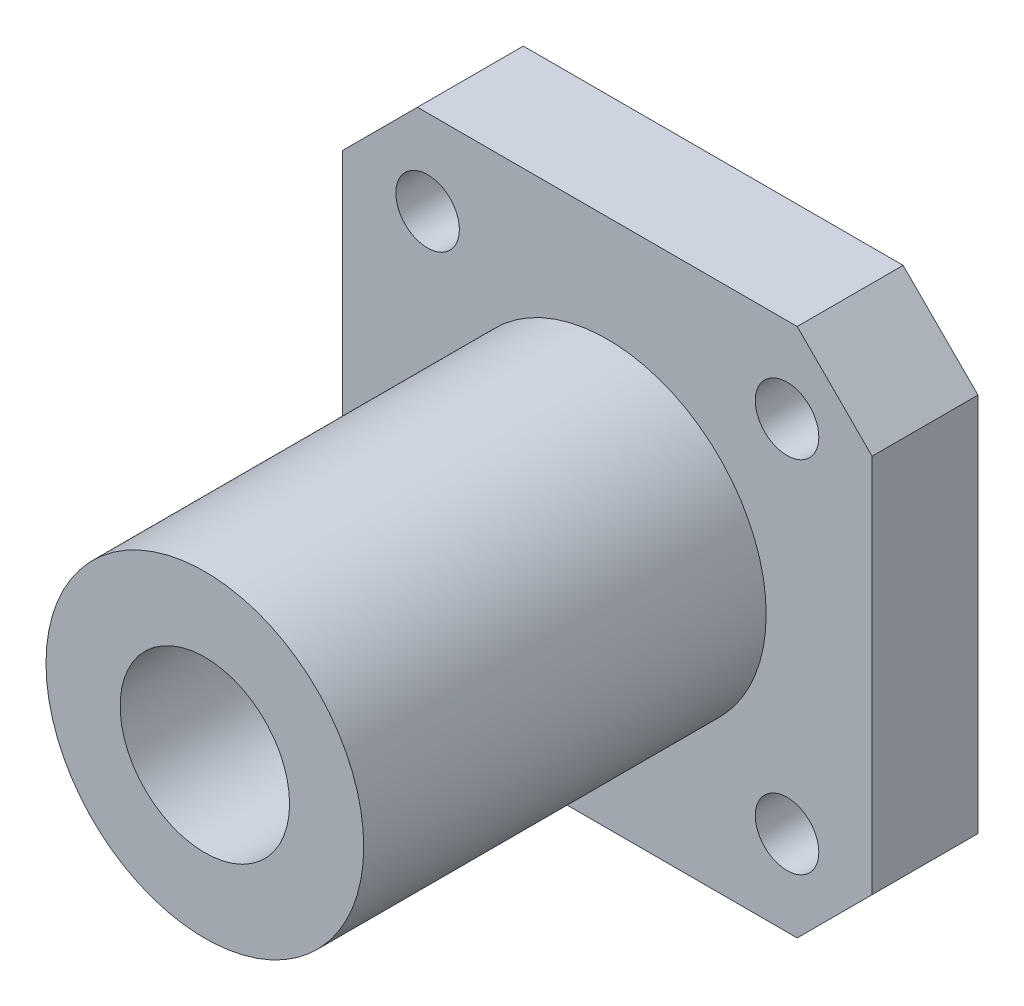
from build123d import *

# Parameters (mm, degrees)
SKETCH2_R           = 1.5
SKETCH2_R_2         = 4
BOSS_EXTRUDE1_DEPTH = 5
SKETCH3_R           = 7.5
SKETCH3_R_2         = 4
BOSS_EXTRUDE2_DEPTH = 19


with BuildPart() as part:
    # Sketch2 → Boss-Extrude1 (new body)
    with BuildSketch(Plane.XY):
        Polygon((-8.964466094, 12.5), (8.964466094, 12.5), (12.5, 8.964466094), (12.5, -8.964466094), (8.964466094, -12.5), (-8.964466094, -12.5), (-12.5, -8.964466094), (-12.5, 8.964466094), align=None)
        with Locations((-8.485281374, 8.485281374)):
            Circle(SKETCH2_R, mode=Mode.SUBTRACT)
        with Locations((8.485281374, -8.485281374)):
            Circle(SKETCH2_R, mode=Mode.SUBTRACT)
        with Locations((8.485281374, 8.485281374)):
            Circle(SKETCH2_R, mode=Mode.SUBTRACT)
        with Locations((-8.485281374, -8.485281374)):
            Circle(SKETCH2_R, mode=Mode.SUBTRACT)
        Circle(SKETCH2_R_2, mode=Mode.SUBTRACT)
    extrude(amount=BOSS_EXTRUDE1_DEPTH)

    # Sketch3 → Boss-Extrude2 (add)
    with BuildSketch(Plane.XY.offset(5)):
        Circle(SKETCH3_R)
        Circle(SKETCH3_R_2, mode=Mode.SUBTRACT)
    extrude(amount=BOSS_EXTRUDE2_DEPTH)


solid = part.part
